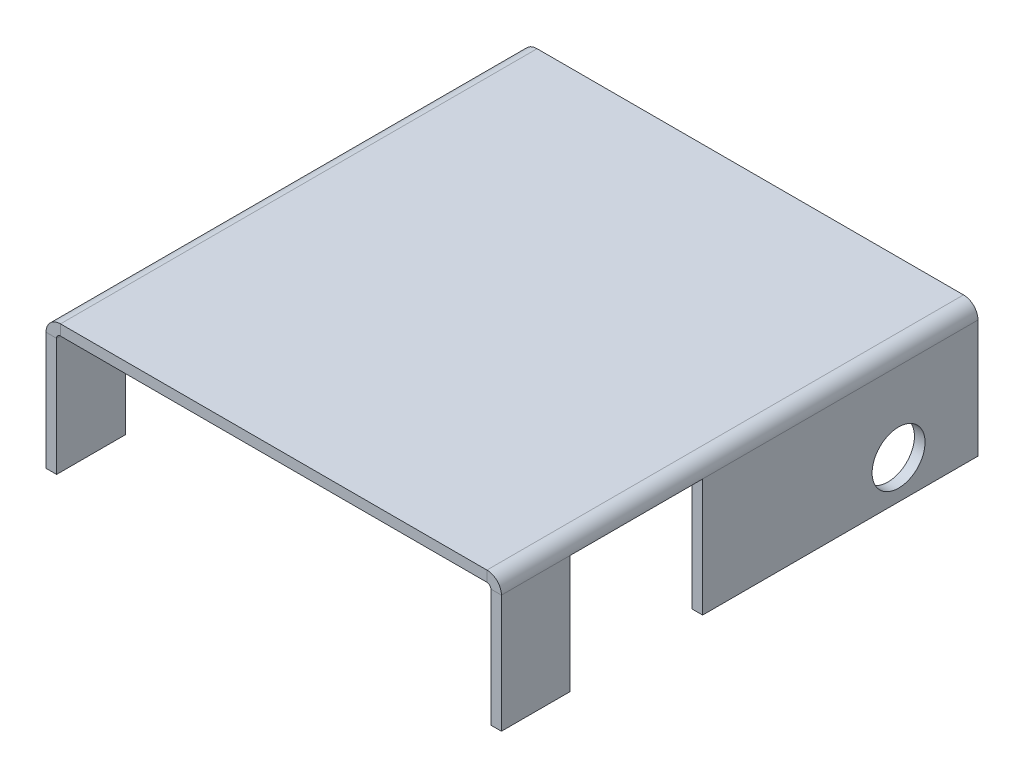
from build123d import *

# Parameters (mm, degrees)
SKETCH1_W                    = 86
SKETCH1_H                    = 90
BASE_FLANGE1_DEPTH           = 2
EDGE_FLANGE1_STRIP_W         = 9.4732
EDGE_FLANGE1_STRIP_H         = 2
EDGE_FLANGE1_STRIP_CUT_DEPTH = 90
EDGE_FLANGE1_DEPTH           = 90
EDGE_FLANGE2_STRIP_W         = 9.4732
EDGE_FLANGE2_STRIP_H         = 2
EDGE_FLANGE2_STRIP_CUT_DEPTH = 90
EDGE_FLANGE2_DEPTH           = 90
SKETCH13_W                   = 25
SKETCH13_H                   = 22.2634
CUT_EXTRUDE1_DEPTH           = 127.980922721
SKETCH15_R                   = 5
CUT_EXTRUDE2_DEPTH           = 127.980922721


# Sheet-metal steps are written as plain solids
with BuildPart() as part:
    # Sketch1 → Base-Flange1 (new body)
    with BuildSketch(Plane(origin=(0, 0, 0), x_dir=(1, 0, 0), z_dir=(0, 1, 0))):
        with Locations((47.016874378, 45.0175246)):
            Rectangle(SKETCH1_W, SKETCH1_H)
    extrude(amount=-BASE_FLANGE1_DEPTH)

    # Edge-Flange1 strip (across the edge) → Edge-Flange1 strip cut (cut)
    with BuildSketch(Plane(origin=(90.016874378, -2, -90.0175246), x_dir=(-1, 0, 0), z_dir=(0, 0, 1))):
        with Locations((-2, -1)):
            Rectangle(EDGE_FLANGE1_STRIP_W, EDGE_FLANGE1_STRIP_H)
    extrude(amount=EDGE_FLANGE1_STRIP_CUT_DEPTH, mode=Mode.SUBTRACT)

    # Edge-Flange1 section (across the edge) → Edge-Flange1 (add)
    with BuildSketch(Plane(origin=(90.016874378, -2, -90.0175246), x_dir=(-1, 0, 0), z_dir=(0, 0, 1))):
        with BuildLine():
            Line((0, 0.7366), (0, 23))
            Line((0, 23), (2, 23))
            Line((2, 23), (2, 0.7366))
            ThreePointArc((2, 0.7366), (2.215745145, 0.215745145), (2.7366, 0))
            Line((2.7366, 0), (2.7366, -2))
            ThreePointArc((2.7366, -2), (0.801531583, -1.198468417), (0, 0.7366))
        make_face()
    extrude(amount=EDGE_FLANGE1_DEPTH)

    # Edge-Flange2 strip (across the edge) → Edge-Flange2 strip cut (cut)
    with BuildSketch(Plane(origin=(4.016874378, -2, -0.0175246), x_dir=(1, 0, 0), z_dir=(0, 0, -1))):
        with Locations((-2, -1)):
            Rectangle(EDGE_FLANGE2_STRIP_W, EDGE_FLANGE2_STRIP_H)
    extrude(amount=EDGE_FLANGE2_STRIP_CUT_DEPTH, mode=Mode.SUBTRACT)

    # Edge-Flange2 section (across the edge) → Edge-Flange2 (add)
    with BuildSketch(Plane(origin=(4.016874378, -2, -0.0175246), x_dir=(1, 0, 0), z_dir=(0, 0, -1))):
        with BuildLine():
            Line((0, 0.7366), (0, 23))
            Line((0, 23), (2, 23))
            Line((2, 23), (2, 0.7366))
            ThreePointArc((2, 0.7366), (2.215745145, 0.215745145), (2.7366, 0))
            Line((2.7366, 0), (2.7366, -2))
            ThreePointArc((2.7366, -2), (0.801531583, -1.198468417), (0, 0.7366))
        make_face()
    extrude(amount=EDGE_FLANGE2_DEPTH)

    # Sketch13 → Cut-Extrude1 (cut, through all)
    with BuildSketch(Plane(origin=(90.016874378, 0, 0), x_dir=(0, 0, -1), z_dir=(1, 0, 0))):
        with Locations((25.5175246, -13.8683)):
            Rectangle(SKETCH13_W, SKETCH13_H)
    extrude(amount=-CUT_EXTRUDE1_DEPTH, mode=Mode.SUBTRACT)

    # Sketch15 → Cut-Extrude2 (cut, through all)
    with BuildSketch(Plane.ZY.offset(-4.016874378)):
        with Locations(Location((-75.0175246, -17.7366, 0), (0, 0, 270))):
            Circle(SKETCH15_R)
    extrude(amount=-CUT_EXTRUDE2_DEPTH, mode=Mode.SUBTRACT)


solid = part.part
